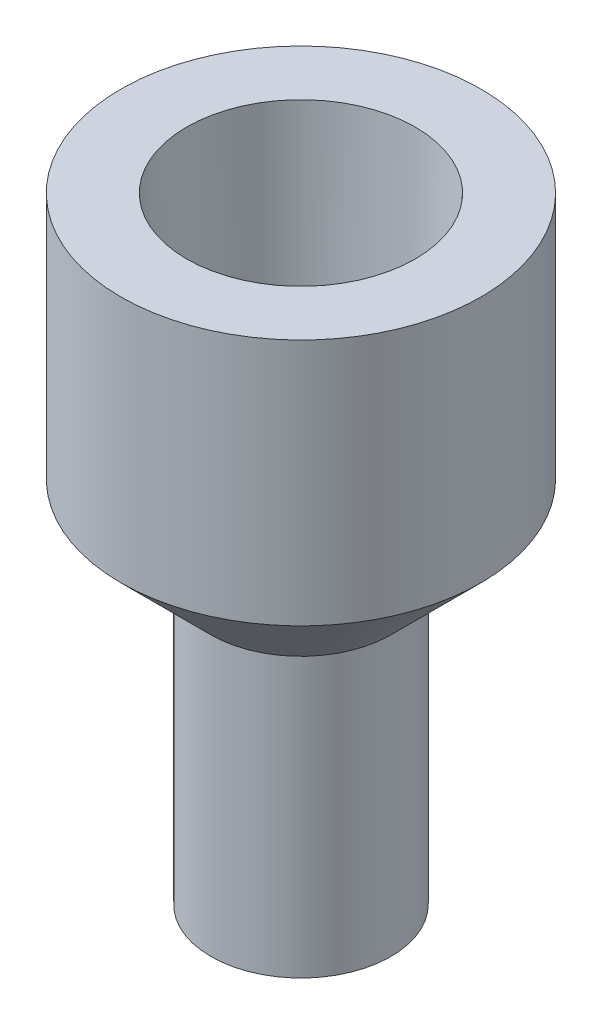
from build123d import *

# Parameters (mm, degrees)
SKETCH1_R           = 5.08
BOSS_EXTRUDE1_DEPTH = 20.8
SKETCH2_R           = 10.16
BOSS_EXTRUDE2_DEPTH = 13.97
SKETCH4_R           = 6.052157879
SKETCH3_R           = 6.450000054
CHAMFER1_SIZE       = 5.08


with BuildPart() as part:
    # Sketch1 → Boss-Extrude1 (new body)
    with BuildSketch(Plane(origin=(0, 0, 0), x_dir=(1, 0, 0), z_dir=(0, 1, 0))):
        with Locations(Location((0, 0, 0), (0, 0, 270))):
            Circle(SKETCH1_R)
    extrude(amount=BOSS_EXTRUDE1_DEPTH)

    # Sketch2 → Boss-Extrude2 (add)
    with BuildSketch(Plane(origin=(0, 20.8, 0), x_dir=(1, 0, 0), z_dir=(0, 1, 0))):
        with Locations(Location((0, 0, 0), (0, 0, 270))):
            Circle(SKETCH2_R)
    extrude(amount=BOSS_EXTRUDE2_DEPTH)

    # Sketch4 → Cut-Loft1 section 0
    with BuildSketch(Plane(origin=(0, 23.34, 0), x_dir=(-1, 0, 0), z_dir=(0, -1, 0))):
        Circle(SKETCH4_R)
    # Sketch3 → Cut-Loft1 section 1
    with BuildSketch(Plane(origin=(0, 34.77, 0), x_dir=(1, 0, 0), z_dir=(0, 1, 0))):
        Circle(SKETCH3_R)
    loft(mode=Mode.SUBTRACT)

    # Chamfer1
    chamfer1_edges = [part.edges().sort_by_distance(p)[0] for p in [
        (0, 20.8, -5.08),
    ]]
    chamfer(chamfer1_edges, length=CHAMFER1_SIZE - 0.0001)  # a hair under: the kernel refuses the full size

    # Cut-Loft2: read off the stored shape, not the designer's step
    # Cut-Loft2: loft between two sections, ruled curve by curve
    cut_loft2_from = [
        Edge.make_bspline([(-1.686897944, 18.26, -1.600000102), (-1.546323115, 18.26, -1.600000102), (-1.405748287, 18.26, -1.600000102), (-1.124598629, 18.26, -1.600000102), (-0.984023801, 18.26, -1.600000102), (-0.702874143, 18.26, -1.600000102), (-0.562299315, 18.26, -1.600000102), (-0.281149657, 18.26, -1.600000102), (-0.140574829, 18.26, -1.600000102), (0.140574829, 18.26, -1.600000102), (0.281149657, 18.26, -1.600000102), (0.562299315, 18.26, -1.600000102), (0.702874143, 18.26, -1.600000102), (0.984023801, 18.26, -1.600000102), (1.124598629, 18.26, -1.600000102), (1.405748287, 18.26, -1.600000102), (1.546323115, 18.26, -1.600000102), (1.686897944, 18.26, -1.600000102)], [0, 0, 0, 0, 0.125, 0.125, 0.25, 0.25, 0.375, 0.375, 0.5, 0.5, 0.625, 0.625, 0.75, 0.75, 0.875, 0.875, 1, 1, 1, 1], 3),
        Edge.make_bspline([(1.686897944, 18.26, -1.600000102), (3.329599086, 18.26, 0.131918024), (2.387049944, 18.26, 2.325), (-2.387049944, 18.26, 2.325), (-3.329599086, 18.26, 0.131918024), (-1.686897944, 18.26, -1.600000102)], [0, 0, 0, 0, 0.5, 0.5, 1, 1, 1, 1], 3, [1, 0.355899276, 0.212319878, 0.212319878, 0.355899276, 1]),
    ]
    cut_loft2_to = [
        Edge.make_bspline([(-2.182602074, 0, -1.269595679), (-2.091149197, 0, -1.426815211), (-1.976752522, 0, -1.584210464), (-1.696673404, 0, -1.88110943), (-1.530809339, 0, -2.020452874), (-1.151990541, 0, -2.25799133), (-0.939007592, 0, -2.355871773), (-0.483917032, 0, -2.489516293), (-0.242057859, 0, -2.525), (0.242057859, 0, -2.525), (0.483917032, 0, -2.489516293), (0.939007592, 0, -2.355871773), (1.151990541, 0, -2.25799133), (1.530809339, 0, -2.020452874), (1.696673404, 0, -1.88110943), (1.976752522, 0, -1.584210464), (2.091149197, 0, -1.426815211), (2.182602074, 0, -1.269595679)], [0, 0, 0, 0, 0.125, 0.125, 0.25, 0.25, 0.375, 0.375, 0.5, 0.5, 0.625, 0.625, 0.75, 0.75, 0.875, 0.875, 1, 1, 1, 1], 3),
        Edge.make_bspline([(2.182602074, 0, -1.269595679), (3.284684333, 0, 0.625028778), (2.191845601, 0, 2.525), (-2.191845601, 0, 2.525), (-3.284684333, 0, 0.625028778), (-2.182602074, 0, -1.269595679)], [0, 0, 0, 0, 0.5, 0.5, 1, 1, 1, 1], 3, [1, 0.4431946, 0.295047331, 0.295047331, 0.4431946, 1]),
    ]
    cut_loft2 = Solid(Shell([*[Face.make_surface_from_curves(cut_loft2_from[k], cut_loft2_to[k]) for k in range(2)], Face(Wire(cut_loft2_from)), Face(Wire(cut_loft2_to))]))
    add(cut_loft2, mode=Mode.SUBTRACT)


solid = part.part
